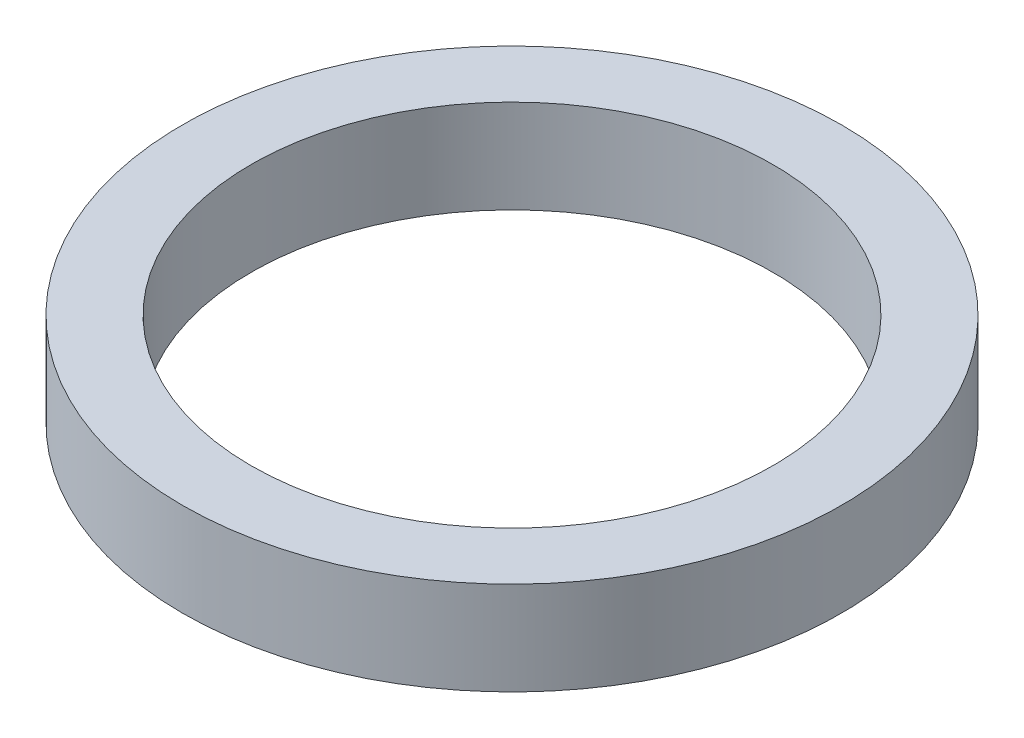
from build123d import *

# Parameters (mm, degrees)
SKETCH1_R           = 60
BOSS_EXTRUDE1_DEPTH = 17
SKETCH2_R           = 47.5
CUT_EXTRUDE1_DEPTH  = 87.539008545


with BuildPart() as part:
    # Sketch1 → Boss-Extrude1 (new body)
    with BuildSketch(Plane(origin=(0, 0, 0), x_dir=(1, 0, 0), z_dir=(0, 1, 0))):
        Circle(SKETCH1_R)
    extrude(amount=BOSS_EXTRUDE1_DEPTH)

    # Sketch2 → Cut-Extrude1 (cut, through all)
    with BuildSketch(Plane(origin=(0, 0, 0), x_dir=(1, 0, 0), z_dir=(0, 1, 0))):
        Circle(SKETCH2_R)
    extrude(amount=CUT_EXTRUDE1_DEPTH, mode=Mode.SUBTRACT)


solid = part.part
